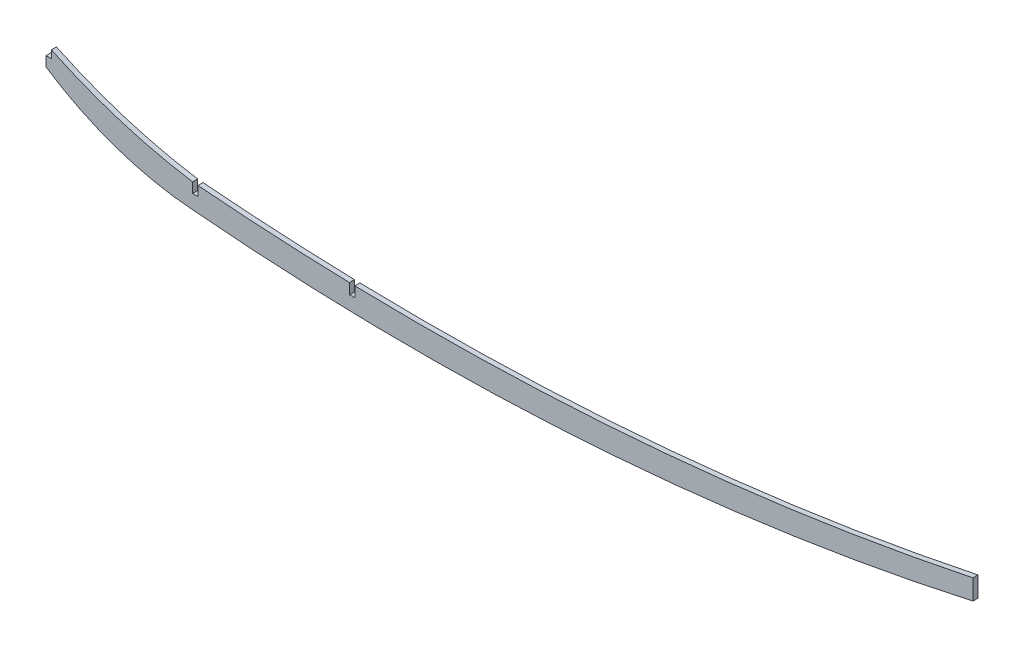
from build123d import *

# Parameters (mm, degrees)
BOSS_EXTRUDE1_DEPTH = 1.5875
SKETCH2_W           = 3.3782
SKETCH2_H           = 6.477
SKETCH2_H_2         = 12.7
CUT_EXTRUDE1_DEPTH  = 600.054534432


with BuildPart() as part:
    # Sketch1 → Boss-Extrude1 (new, symmetric)
    with BuildSketch(Plane.XY):
        with BuildLine():
            Line((0, -84.863004684), (0, -97.563004684))
            ThreePointArc((0, -97.563004684), (44.158404147, -119.360611557), (92.3925, -129.288970912))
            ThreePointArc((92.3925, -129.288970912), (339.198389145, -132.023125314), (583.522463964, -97.003573898))
            Line((583.522463964, -97.003573898), (583.522463964, -84.303573898))
            ThreePointArc((583.522463964, -84.303573898), (339.042339878, -117.088496575), (92.3925, -114.048970912))
            ThreePointArc((92.3925, -114.048970912), (45.091480007, -102.953300884), (0, -84.863004684))
        make_face()
    extrude(amount=BOSS_EXTRUDE1_DEPTH, both=True)

    # Sketch2 → Cut-Extrude1 (cut, through all)
    with BuildSketch(Plane.XY.offset(1.5875)):
        with Locations((1.6891, -88.101504684)):
            Rectangle(SKETCH2_W, SKETCH2_H)
        with Locations((93.98, -114.06579143)):
            Rectangle(SKETCH2_W, SKETCH2_H_2)
        Polygon((191.155368795, -126.195526401), (194.532828758, -126.124819669), (194.267013976, -113.427601765), (190.889554014, -113.498308497), align=None)
    extrude(amount=-CUT_EXTRUDE1_DEPTH, mode=Mode.SUBTRACT)


solid = part.part
